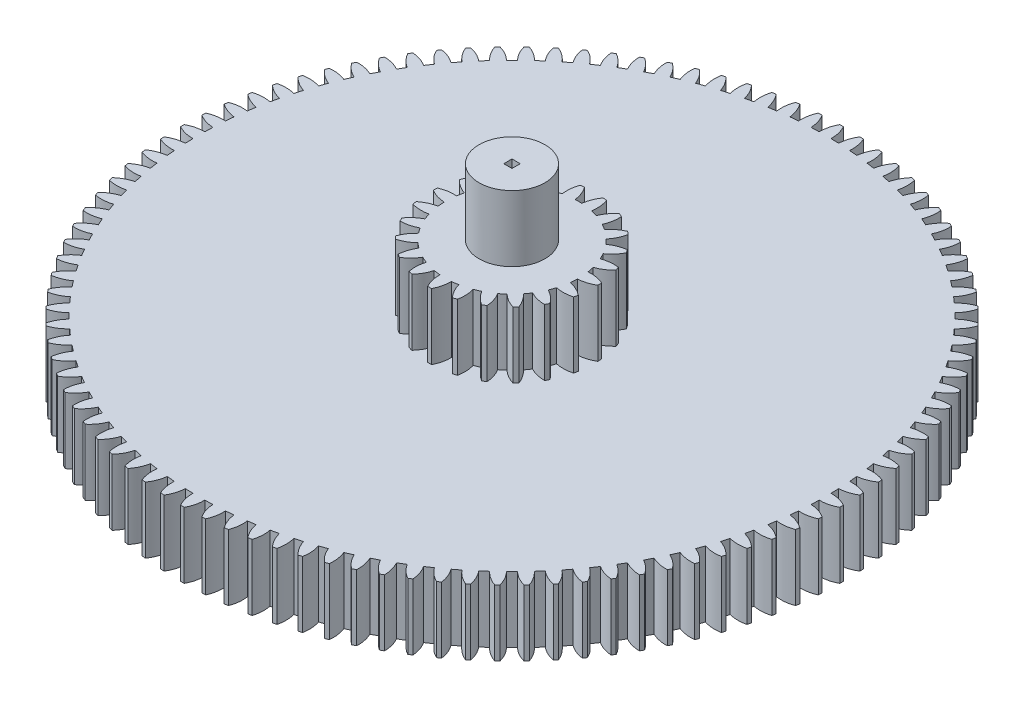
from build123d import *

# Parameters (mm, degrees)
BOSS_EXTRUDE1_DEPTH      = 1
BOSS_EXTRUDE2_DEPTH      = 2
BOSS_EXTRUDE2_DEPTH_BACK = 3
SKETCH2_R                = 0.5
BOSS_EXTRUDE3_DEPTH      = 1
SCALE1_SCALE             = 2
SKETCH4_W                = 0.25
SKETCH4_H                = 0.25
CUT_EXTRUDE1_DEPTH       = 1
SKETCH5_R                = 1
CUT_EXTRUDE2_DEPTH       = 1.4
SKETCH6_R                = 5
SKETCH6_R_2              = 1
CUT_EXTRUDE3_DEPTH       = 2
BOSS_EXTRUDE4_DEPTH      = 2


with BuildPart() as part:
    # Sketch1 → Boss-Extrude1 (new body)
    with BuildSketch(Plane(origin=(0, 0, 0), x_dir=(1, 0, 0), z_dir=(0, 1, 0))):
        with BuildLine():
            ThreePointArc((-1.122849348, 2.23365381), (-1.150162594, 2.219713046), (-1.17730279, 2.20543831))
            ThreePointArc((-1.17730279, 2.20543831), (-1.174225974, 2.07727607), (-1.131251341, 1.956494417))
            ThreePointArc((-1.131251341, 1.956494417), (-1.174259727, 1.930987854), (-1.216693282, 1.904536022))
            ThreePointArc((-1.216693282, 1.904536022), (-1.3041624, 1.998259979), (-1.416540223, 2.059954804))
            ThreePointArc((-1.416540223, 2.059954804), (-1.441700805, 2.042424733), (-1.466644473, 2.024587363))
            ThreePointArc((-1.466644473, 2.024587363), (-1.446144892, 1.898037792), (-1.387124094, 1.784232818))
            ThreePointArc((-1.387124094, 1.784232818), (-1.426258754, 1.753107517), (-1.464695223, 1.721124023))
            ThreePointArc((-1.464695223, 1.721124023), (-1.564111726, 1.802064654), (-1.683843634, 1.847882739))
            ThreePointArc((-1.683843634, 1.847882739), (-1.706382858, 1.827089911), (-1.728665344, 1.806022184))
            ThreePointArc((-1.728665344, 1.806022184), (-1.691124866, 1.683442662), (-1.617157349, 1.578734337))
            ThreePointArc((-1.617157349, 1.578734337), (-1.651689279, 1.542570104), (-1.685412664, 1.505650741))
            ThreePointArc((-1.685412664, 1.505650741), (-1.79492461, 1.572300274), (-1.919780224, 1.601388114))
            ThreePointArc((-1.919780224, 1.601388114), (-1.939278227, 1.577719861), (-1.958484451, 1.553814228))
            ThreePointArc((-1.958484451, 1.553814228), (-1.904602384, 1.43748818), (-1.817066023, 1.343827023))
            ThreePointArc((-1.817066023, 1.343827023), (-1.846351958, 1.303297528), (-1.874734055, 1.262130034))
            ThreePointArc((-1.874734055, 1.262130034), (-1.992301445, 1.313246914), (-2.119954941, 1.325062658))
            ThreePointArc((-2.119954941, 1.325062658), (-2.136048511, 1.298959875), (-2.151820698, 1.272661654))
            ThreePointArc((-2.151820698, 1.272661654), (-2.082600763, 1.164756013), (-1.983126195, 1.083886754))
            ThreePointArc((-1.983126195, 1.083886754), (-2.006620594, 1.039746985), (-2.029132698, 0.995098232))
            ThreePointArc((-2.029132698, 0.995098232), (-2.152565474, 1.02973025), (-2.280638908, 1.024053793))
            ThreePointArc((-2.280638908, 1.024053793), (-2.293028254, 0.996002725), (-2.305072596, 0.967801801))
            ThreePointArc((-2.305072596, 0.967801801), (-2.22180423, 0.870326645), (-2.112244478, 0.803755726))
            ThreePointArc((-2.112244478, 0.803755726), (-2.129509684, 0.756827924), (-2.145732439, 0.709529634))
            ThreePointArc((-2.145732439, 0.709529634), (-2.272731281, 0.727031659), (-2.398838888, 0.703968742))
            ThreePointArc((-2.398838888, 0.703968742), (-2.407293218, 0.674491928), (-2.415385354, 0.644913631))
            ThreePointArc((-2.415385354, 0.644913631), (-2.319619689, 0.559684739), (-2.202015642, 0.508652249))
            ThreePointArc((-2.202015642, 0.508652249), (-2.212730038, 0.459810589), (-2.222361244, 0.41074384))
            ThreePointArc((-2.222361244, 0.41074384), (-2.350560404, 0.410789844), (-2.472353038, 0.370770087))
            ThreePointArc((-2.472353038, 0.370770087), (-2.476714865, 0.340416623), (-2.480704053, 0.310011941))
            ThreePointArc((-2.480704053, 0.310011941), (-2.374225021, 0.238616965), (-2.250767422, 0.204073543))
            ThreePointArc((-2.250767422, 0.204073543), (-2.254731418, 0.154227854), (-2.257591664, 0.104306666))
            ThreePointArc((-2.257591664, 0.104306666), (-2.384603034, 0.086895792), (-2.499811928, 0.030664685))
            ThreePointArc((-2.499811928, 0.030664685), (-2.5, 0), (-2.499811928, -0.030664685))
            ThreePointArc((-2.499811928, -0.030664685), (-2.384603034, -0.086895792), (-2.257591664, -0.104306666))
            ThreePointArc((-2.257591664, -0.104306666), (-2.254731418, -0.154227854), (-2.250767422, -0.204073543))
            ThreePointArc((-2.250767422, -0.204073543), (-2.374225021, -0.238616965), (-2.480704053, -0.310011941))
            ThreePointArc((-2.480704053, -0.310011941), (-2.476714865, -0.340416623), (-2.472353038, -0.370770087))
            ThreePointArc((-2.472353038, -0.370770087), (-2.350560404, -0.410789844), (-2.222361244, -0.41074384))
            ThreePointArc((-2.222361244, -0.41074384), (-2.212730038, -0.459810589), (-2.202015642, -0.508652249))
            ThreePointArc((-2.202015642, -0.508652249), (-2.319619689, -0.559684739), (-2.415385354, -0.644913631))
            ThreePointArc((-2.415385354, -0.644913631), (-2.407293218, -0.674491928), (-2.398838888, -0.703968742))
            ThreePointArc((-2.398838888, -0.703968742), (-2.272731281, -0.727031659), (-2.145732439, -0.709529634))
            ThreePointArc((-2.145732439, -0.709529634), (-2.129509684, -0.756827924), (-2.112244478, -0.803755726))
            ThreePointArc((-2.112244478, -0.803755726), (-2.22180423, -0.870326645), (-2.305072596, -0.967801801))
            ThreePointArc((-2.305072596, -0.967801801), (-2.293028254, -0.996002725), (-2.280638908, -1.024053793))
            ThreePointArc((-2.280638908, -1.024053793), (-2.152565474, -1.02973025), (-2.029132698, -0.995098232))
            ThreePointArc((-2.029132698, -0.995098232), (-2.006620594, -1.039746985), (-1.983126195, -1.083886754))
            ThreePointArc((-1.983126195, -1.083886754), (-2.082600763, -1.164756013), (-2.151820698, -1.272661654))
            ThreePointArc((-2.151820698, -1.272661654), (-2.136048511, -1.298959875), (-2.119954941, -1.325062658))
            ThreePointArc((-2.119954941, -1.325062658), (-1.992301445, -1.313246914), (-1.874734055, -1.262130034))
            ThreePointArc((-1.874734055, -1.262130034), (-1.846351958, -1.303297528), (-1.817066023, -1.343827023))
            ThreePointArc((-1.817066023, -1.343827023), (-1.904602384, -1.43748818), (-1.958484451, -1.553814228))
            ThreePointArc((-1.958484451, -1.553814228), (-1.939278227, -1.577719861), (-1.919780224, -1.601388114))
            ThreePointArc((-1.919780224, -1.601388114), (-1.79492461, -1.572300274), (-1.685412664, -1.505650741))
            ThreePointArc((-1.685412664, -1.505650741), (-1.651689279, -1.542570104), (-1.617157349, -1.578734337))
            ThreePointArc((-1.617157349, -1.578734337), (-1.691124866, -1.683442662), (-1.728665344, -1.806022184))
            ThreePointArc((-1.728665344, -1.806022184), (-1.706382858, -1.827089911), (-1.683843634, -1.847882739))
            ThreePointArc((-1.683843634, -1.847882739), (-1.564111726, -1.802064654), (-1.464695223, -1.721124023))
            ThreePointArc((-1.464695223, -1.721124023), (-1.426258754, -1.753107517), (-1.387124094, -1.784232818))
            ThreePointArc((-1.387124094, -1.784232818), (-1.446144892, -1.898037792), (-1.466644473, -2.024587363))
            ThreePointArc((-1.466644473, -2.024587363), (-1.441700805, -2.042424733), (-1.416540223, -2.059954804))
            ThreePointArc((-1.416540223, -2.059954804), (-1.3041624, -1.998259979), (-1.216693282, -1.904536022))
            ThreePointArc((-1.216693282, -1.904536022), (-1.174259727, -1.930987854), (-1.131251341, -1.956494417))
            ThreePointArc((-1.131251341, -1.956494417), (-1.174225974, -2.07727607), (-1.17730279, -2.20543831))
            ThreePointArc((-1.17730279, -2.20543831), (-1.150162594, -2.219713046), (-1.122849348, -2.23365381))
            ThreePointArc((-1.122849348, -2.23365381), (-1.019918995, -2.157231501), (-0.946026647, -2.052470118))
            ThreePointArc((-0.946026647, -2.052470118), (-0.900386463, -2.072897541), (-0.854305516, -2.092310227))
            ThreePointArc((-0.854305516, -2.092310227), (-0.880433448, -2.217818624), (-0.866030184, -2.345206115))
            ThreePointArc((-0.866030184, -2.345206115), (-0.83719903, -2.355652305), (-0.808241914, -2.365744071))
            ThreePointArc((-0.808241914, -2.365744071), (-0.71667643, -2.276017883), (-0.657737325, -2.162170579))
            ThreePointArc((-0.657737325, -2.162170579), (-0.609740703, -2.176193069), (-0.561445596, -2.189150256))
            ThreePointArc((-0.561445596, -2.189150256), (-0.570240113, -2.317047414), (-0.538625074, -2.441287167))
            ThreePointArc((-0.538625074, -2.441287167), (-0.508640033, -2.447710219), (-0.478578463, -2.453764996))
            ThreePointArc((-0.478578463, -2.453764996), (-0.400083539, -2.352406357), (-0.357195602, -2.231593893))
            ThreePointArc((-0.357195602, -2.231593893), (-0.307736627, -2.238950238), (-0.258127007, -2.245210558))
            ThreePointArc((-0.258127007, -2.245210558), (-0.249424284, -2.373113995), (-0.201186398, -2.491891658))
            ThreePointArc((-0.201186398, -2.491891658), (-0.170606033, -2.494171923), (-0.14, -2.496076922))
            ThreePointArc((-0.14, -2.496076922), (-0.076037848, -2.384973952), (-0.05, -2.259446835))
            ThreePointArc((-0.05, -2.259446835), (0, -2.26), (0.05, -2.259446835))
            ThreePointArc((0.05, -2.259446835), (0.076037848, -2.384973952), (0.14, -2.496076922))
            ThreePointArc((0.14, -2.496076922), (0.170606033, -2.494171923), (0.201186398, -2.491891658))
            ThreePointArc((0.201186398, -2.491891658), (0.249424284, -2.373113995), (0.258127007, -2.245210558))
            ThreePointArc((0.258127007, -2.245210558), (0.307736627, -2.238950238), (0.357195602, -2.231593893))
            ThreePointArc((0.357195602, -2.231593893), (0.400083539, -2.352406357), (0.478578463, -2.453764996))
            ThreePointArc((0.478578463, -2.453764996), (0.508640033, -2.447710219), (0.538625074, -2.441287167))
            ThreePointArc((0.538625074, -2.441287167), (0.570240113, -2.317047414), (0.561445596, -2.189150256))
            ThreePointArc((0.561445596, -2.189150256), (0.609740703, -2.176193069), (0.657737325, -2.162170579))
            ThreePointArc((0.657737325, -2.162170579), (0.71667643, -2.276017883), (0.808241914, -2.365744071))
            ThreePointArc((0.808241914, -2.365744071), (0.83719903, -2.355652305), (0.866030184, -2.345206115))
            ThreePointArc((0.866030184, -2.345206115), (0.880433448, -2.217818624), (0.854305516, -2.092310227))
            ThreePointArc((0.854305516, -2.092310227), (0.900386463, -2.072897541), (0.946026647, -2.052470118))
            ThreePointArc((0.946026647, -2.052470118), (1.019918995, -2.157231501), (1.122849348, -2.23365381))
            ThreePointArc((1.122849348, -2.23365381), (1.150162594, -2.219713046), (1.17730279, -2.20543831))
            ThreePointArc((1.17730279, -2.20543831), (1.174225974, -2.07727607), (1.131251341, -1.956494417))
            ThreePointArc((1.131251341, -1.956494417), (1.174259727, -1.930987854), (1.216693282, -1.904536022))
            ThreePointArc((1.216693282, -1.904536022), (1.3041624, -1.998259979), (1.416540223, -2.059954804))
            ThreePointArc((1.416540223, -2.059954804), (1.441700805, -2.042424733), (1.466644473, -2.024587363))
            ThreePointArc((1.466644473, -2.024587363), (1.446144892, -1.898037792), (1.387124094, -1.784232818))
            ThreePointArc((1.387124094, -1.784232818), (1.426258754, -1.753107517), (1.464695223, -1.721124023))
            ThreePointArc((1.464695223, -1.721124023), (1.564111726, -1.802064654), (1.683843634, -1.847882739))
            ThreePointArc((1.683843634, -1.847882739), (1.706382858, -1.827089911), (1.728665344, -1.806022184))
            ThreePointArc((1.728665344, -1.806022184), (1.691124866, -1.683442662), (1.617157349, -1.578734337))
            ThreePointArc((1.617157349, -1.578734337), (1.651689279, -1.542570104), (1.685412664, -1.505650741))
            ThreePointArc((1.685412664, -1.505650741), (1.79492461, -1.572300274), (1.919780224, -1.601388114))
            ThreePointArc((1.919780224, -1.601388114), (1.939278227, -1.577719861), (1.958484451, -1.553814228))
            ThreePointArc((1.958484451, -1.553814228), (1.904602384, -1.43748818), (1.817066023, -1.343827023))
            ThreePointArc((1.817066023, -1.343827023), (1.846351958, -1.303297528), (1.874734055, -1.262130034))
            ThreePointArc((1.874734055, -1.262130034), (1.992301445, -1.313246914), (2.119954941, -1.325062658))
            ThreePointArc((2.119954941, -1.325062658), (2.136048511, -1.298959875), (2.151820698, -1.272661654))
            ThreePointArc((2.151820698, -1.272661654), (2.082600763, -1.164756013), (1.983126195, -1.083886754))
            ThreePointArc((1.983126195, -1.083886754), (2.006620594, -1.039746985), (2.029132698, -0.995098232))
            ThreePointArc((2.029132698, -0.995098232), (2.152565474, -1.02973025), (2.280638908, -1.024053793))
            ThreePointArc((2.280638908, -1.024053793), (2.293028254, -0.996002725), (2.305072596, -0.967801801))
            ThreePointArc((2.305072596, -0.967801801), (2.22180423, -0.870326645), (2.112244478, -0.803755726))
            ThreePointArc((2.112244478, -0.803755726), (2.129509684, -0.756827924), (2.145732439, -0.709529634))
            ThreePointArc((2.145732439, -0.709529634), (2.272731281, -0.727031659), (2.398838888, -0.703968742))
            ThreePointArc((2.398838888, -0.703968742), (2.407293218, -0.674491928), (2.415385354, -0.644913631))
            ThreePointArc((2.415385354, -0.644913631), (2.319619689, -0.559684739), (2.202015642, -0.508652249))
            ThreePointArc((2.202015642, -0.508652249), (2.212730038, -0.459810589), (2.222361244, -0.41074384))
            ThreePointArc((2.222361244, -0.41074384), (2.350560404, -0.410789844), (2.472353038, -0.370770087))
            ThreePointArc((2.472353038, -0.370770087), (2.476714865, -0.340416623), (2.480704053, -0.310011941))
            ThreePointArc((2.480704053, -0.310011941), (2.374225021, -0.238616965), (2.250767422, -0.204073543))
            ThreePointArc((2.250767422, -0.204073543), (2.254731418, -0.154227854), (2.257591664, -0.104306666))
            ThreePointArc((2.257591664, -0.104306666), (2.384603034, -0.086895792), (2.499811928, -0.030664685))
            ThreePointArc((2.499811928, -0.030664685), (2.5, 0), (2.499811928, 0.030664685))
            ThreePointArc((2.499811928, 0.030664685), (2.384603034, 0.086895792), (2.257591664, 0.104306666))
            ThreePointArc((2.257591664, 0.104306666), (2.254731418, 0.154227854), (2.250767422, 0.204073543))
            ThreePointArc((2.250767422, 0.204073543), (2.374225021, 0.238616965), (2.480704053, 0.310011941))
            ThreePointArc((2.480704053, 0.310011941), (2.476714865, 0.340416623), (2.472353038, 0.370770087))
            ThreePointArc((2.472353038, 0.370770087), (2.350560404, 0.410789844), (2.222361244, 0.41074384))
            ThreePointArc((2.222361244, 0.41074384), (2.212730038, 0.459810589), (2.202015642, 0.508652249))
            ThreePointArc((2.202015642, 0.508652249), (2.319619689, 0.559684739), (2.415385354, 0.644913631))
            ThreePointArc((2.415385354, 0.644913631), (2.407293218, 0.674491928), (2.398838888, 0.703968742))
            ThreePointArc((2.398838888, 0.703968742), (2.272731281, 0.727031659), (2.145732439, 0.709529634))
            ThreePointArc((2.145732439, 0.709529634), (2.129509684, 0.756827924), (2.112244478, 0.803755726))
            ThreePointArc((2.112244478, 0.803755726), (2.22180423, 0.870326645), (2.305072596, 0.967801801))
            ThreePointArc((2.305072596, 0.967801801), (2.293028254, 0.996002725), (2.280638908, 1.024053793))
            ThreePointArc((2.280638908, 1.024053793), (2.152565474, 1.02973025), (2.029132698, 0.995098232))
            ThreePointArc((2.029132698, 0.995098232), (2.006620594, 1.039746985), (1.983126195, 1.083886754))
            ThreePointArc((1.983126195, 1.083886754), (2.082600763, 1.164756013), (2.151820698, 1.272661654))
            ThreePointArc((2.151820698, 1.272661654), (2.136048511, 1.298959875), (2.119954941, 1.325062658))
            ThreePointArc((2.119954941, 1.325062658), (1.992301445, 1.313246914), (1.874734055, 1.262130034))
            ThreePointArc((1.874734055, 1.262130034), (1.846351958, 1.303297528), (1.817066023, 1.343827023))
            ThreePointArc((1.817066023, 1.343827023), (1.904602384, 1.43748818), (1.958484451, 1.553814228))
            ThreePointArc((1.958484451, 1.553814228), (1.939278227, 1.577719861), (1.919780224, 1.601388114))
            ThreePointArc((1.919780224, 1.601388114), (1.79492461, 1.572300274), (1.685412664, 1.505650741))
            ThreePointArc((1.685412664, 1.505650741), (1.651689279, 1.542570104), (1.617157349, 1.578734337))
            ThreePointArc((1.617157349, 1.578734337), (1.691124866, 1.683442662), (1.728665344, 1.806022184))
            ThreePointArc((1.728665344, 1.806022184), (1.706382858, 1.827089911), (1.683843634, 1.847882739))
            ThreePointArc((1.683843634, 1.847882739), (1.564111726, 1.802064654), (1.464695223, 1.721124023))
            ThreePointArc((1.464695223, 1.721124023), (1.426258754, 1.753107517), (1.387124094, 1.784232818))
            ThreePointArc((1.387124094, 1.784232818), (1.446144892, 1.898037792), (1.466644473, 2.024587363))
            ThreePointArc((1.466644473, 2.024587363), (1.441700805, 2.042424733), (1.416540223, 2.059954804))
            ThreePointArc((1.416540223, 2.059954804), (1.3041624, 1.998259979), (1.216693282, 1.904536022))
            ThreePointArc((1.216693282, 1.904536022), (1.174259727, 1.930987854), (1.131251341, 1.956494417))
            ThreePointArc((1.131251341, 1.956494417), (1.174225974, 2.07727607), (1.17730279, 2.20543831))
            ThreePointArc((1.17730279, 2.20543831), (1.150162594, 2.219713046), (1.122849348, 2.23365381))
            ThreePointArc((1.122849348, 2.23365381), (1.019918995, 2.157231501), (0.946026647, 2.052470118))
            ThreePointArc((0.946026647, 2.052470118), (0.900386463, 2.072897541), (0.854305516, 2.092310227))
            ThreePointArc((0.854305516, 2.092310227), (0.880433448, 2.217818624), (0.866030184, 2.345206115))
            ThreePointArc((0.866030184, 2.345206115), (0.83719903, 2.355652305), (0.808241914, 2.365744071))
            ThreePointArc((0.808241914, 2.365744071), (0.71667643, 2.276017883), (0.657737325, 2.162170579))
            ThreePointArc((0.657737325, 2.162170579), (0.609740703, 2.176193069), (0.561445596, 2.189150256))
            ThreePointArc((0.561445596, 2.189150256), (0.570240113, 2.317047414), (0.538625074, 2.441287167))
            ThreePointArc((0.538625074, 2.441287167), (0.508640033, 2.447710219), (0.478578463, 2.453764996))
            ThreePointArc((0.478578463, 2.453764996), (0.400083539, 2.352406357), (0.357195602, 2.231593893))
            ThreePointArc((0.357195602, 2.231593893), (0.307736627, 2.238950238), (0.258127007, 2.245210558))
            ThreePointArc((0.258127007, 2.245210558), (0.249424284, 2.373113995), (0.201186398, 2.491891658))
            ThreePointArc((0.201186398, 2.491891658), (0.170606033, 2.494171923), (0.14, 2.496076922))
            ThreePointArc((0.14, 2.496076922), (0.076037848, 2.384973952), (0.05, 2.259446835))
            ThreePointArc((0.05, 2.259446835), (0, 2.26), (-0.05, 2.259446835))
            ThreePointArc((-0.05, 2.259446835), (-0.076037848, 2.384973952), (-0.14, 2.496076922))
            ThreePointArc((-0.14, 2.496076922), (-0.170606033, 2.494171923), (-0.201186398, 2.491891658))
            ThreePointArc((-0.201186398, 2.491891658), (-0.249424284, 2.373113995), (-0.258127007, 2.245210558))
            ThreePointArc((-0.258127007, 2.245210558), (-0.307736627, 2.238950238), (-0.357195602, 2.231593893))
            ThreePointArc((-0.357195602, 2.231593893), (-0.400083539, 2.352406357), (-0.478578463, 2.453764996))
            ThreePointArc((-0.478578463, 2.453764996), (-0.508640033, 2.447710219), (-0.538625074, 2.441287167))
            ThreePointArc((-0.538625074, 2.441287167), (-0.570240113, 2.317047414), (-0.561445596, 2.189150256))
            ThreePointArc((-0.561445596, 2.189150256), (-0.609740703, 2.176193069), (-0.657737325, 2.162170579))
            ThreePointArc((-0.657737325, 2.162170579), (-0.71667643, 2.276017883), (-0.808241914, 2.365744071))
            ThreePointArc((-0.808241914, 2.365744071), (-0.83719903, 2.355652305), (-0.866030184, 2.345206115))
            ThreePointArc((-0.866030184, 2.345206115), (-0.880433448, 2.217818624), (-0.854305516, 2.092310227))
            ThreePointArc((-0.854305516, 2.092310227), (-0.900386463, 2.072897541), (-0.946026647, 2.052470118))
            ThreePointArc((-0.946026647, 2.052470118), (-1.019918995, 2.157231501), (-1.122849348, 2.23365381))
        make_face()
    extrude(amount=BOSS_EXTRUDE1_DEPTH)

    # Sketch2 → Boss-Extrude2 (add, two sides: drawn at the far end of the back side and taken through both)
    with BuildSketch(Plane.XZ.offset(-BOSS_EXTRUDE2_DEPTH_BACK)):
        Circle(SKETCH2_R)
    extrude(amount=BOSS_EXTRUDE2_DEPTH + BOSS_EXTRUDE2_DEPTH_BACK)

    # Sketch3 → Boss-Extrude3 (add)
    with BuildSketch(Plane(origin=(0, 1, 0), x_dir=(1, 0, 0), z_dir=(0, 1, 0))):
        with BuildLine():
            ThreePointArc((-0.566857316, 0.835926303), (-0.656545768, 0.92443348), (-0.765012261, 0.988562715))
            ThreePointArc((-0.765012261, 0.988562715), (-0.78885993, 0.969639113), (-0.812239679, 0.95014036))
            ThreePointArc((-0.812239679, 0.95014036), (-0.771519926, 0.830895064), (-0.703111612, 0.725075211))
            ThreePointArc((-0.703111612, 0.725075211), (-0.738144324, 0.689378675), (-0.771366926, 0.651991614))
            ThreePointArc((-0.771366926, 0.651991614), (-0.881608438, 0.71301905), (-1.003354559, 0.74550629))
            ThreePointArc((-1.003354559, 0.74550629), (-1.021212366, 0.720850403), (-1.03846443, 0.695766935))
            ThreePointArc((-1.03846443, 0.695766935), (-0.96708268, 0.591929637), (-0.872661277, 0.508490212))
            ThreePointArc((-0.872661277, 0.508490212), (-0.896764071, 0.464665688), (-0.918667781, 0.41970169))
            ThreePointArc((-0.918667781, 0.41970169), (-1.041286243, 0.44872326), (-1.16728264, 0.447159074))
            ThreePointArc((-1.16728264, 0.447159074), (-1.177826153, 0.418599515), (-1.187671024, 0.38979166))
            ThreePointArc((-1.187671024, 0.38979166), (-1.090921335, 0.309063496), (-0.977489647, 0.254192821))
            ThreePointArc((-0.977489647, 0.254192821), (-0.988874929, 0.205490573), (-0.997835248, 0.156284412))
            ThreePointArc((-0.997835248, 0.156284412), (-1.123736611, 0.151147718), (-1.244638708, 0.115648115))
            ThreePointArc((-1.244638708, 0.115648115), (-1.247085961, 0.085303017), (-1.248793492, 0.05490732))
            ThreePointArc((-1.248793492, 0.05490732), (-1.133851346, 0.003275529), (-1.009822082, -0.018956889))
            ThreePointArc((-1.009822082, -0.018956889), (-1.007645457, -0.068924837), (-1.00299784, -0.118723766))
            ThreePointArc((-1.00299784, -0.118723766), (-1.122844575, -0.157637759), (-1.229685616, -0.224439935))
            ThreePointArc((-1.229685616, -0.224439935), (-1.22385511, -0.254320016), (-1.21729866, -0.284049244))
            ThreePointArc((-1.21729866, -0.284049244), (-1.092688789, -0.302755369), (-0.967260632, -0.290700653))
            ThreePointArc((-0.967260632, -0.290700653), (-0.951683531, -0.338228408), (-0.933772671, -0.384926745))
            ThreePointArc((-0.933772671, -0.384926745), (-1.038676294, -0.454731964), (-1.123532368, -0.547882303))
            ThreePointArc((-1.123532368, -0.547882303), (-1.109856523, -0.575081297), (-1.095522354, -0.601939176))
            ThreePointArc((-1.095522354, -0.601939176), (-0.970486504, -0.586332286), (-0.852961886, -0.54088448))
            ThreePointArc((-0.852961886, -0.54088448), (-0.825139592, -0.582447125), (-0.795293854, -0.622581469))
            ThreePointArc((-0.795293854, -0.622581469), (-0.877474144, -0.71810078), (-0.934051864, -0.830690746))
            ThreePointArc((-0.934051864, -0.830690746), (-0.913544955, -0.853191429), (-0.892496167, -0.875186032))
            ThreePointArc((-0.892496167, -0.875186032), (-0.776307675, -0.826423619), (-0.67540286, -0.750953379))
            ThreePointArc((-0.67540286, -0.750953379), (-0.637398824, -0.783468404), (-0.597831731, -0.814062173))
            ThreePointArc((-0.597831731, -0.814062173), (-0.651193751, -0.928211346), (-0.675297006, -1.051890657))
            ThreePointArc((-0.675297006, -1.051890657), (-0.649479938, -1.068024256), (-0.623277623, -1.083524344))
            ThreePointArc((-0.623277623, -1.083524344), (-0.524553656, -1.005222894), (-0.447752293, -0.905327501))
            ThreePointArc((-0.447752293, -0.905327501), (-0.402385101, -0.926383415), (-0.356031163, -0.94516761))
            ThreePointArc((-0.356031163, -0.94516761), (-0.376617296, -1.069480723), (-0.366458458, -1.19507665))
            ThreePointArc((-0.366458458, -1.19507665), (-0.337245964, -1.203646609), (-0.307833428, -1.211502613))
            ThreePointArc((-0.307833428, -1.211502613), (-0.233895893, -1.109469385), (-0.186893986, -0.992557624))
            ThreePointArc((-0.186893986, -0.992557624), (-0.137528316, -1.000592805), (-0.087825392, -1.006174289))
            ThreePointArc((-0.087825392, -1.006174289), (-0.074108859, -1.131431607), (-0.030441363, -1.249629274))
            ThreePointArc((-0.030441363, -1.249629274), (0, -1.25), (0.030441363, -1.249629274))
            ThreePointArc((0.030441363, -1.249629274), (0.074108859, -1.131431607), (0.087825392, -1.006174289))
            ThreePointArc((0.087825392, -1.006174289), (0.137528316, -1.000592805), (0.186893986, -0.992557624))
            ThreePointArc((0.186893986, -0.992557624), (0.233895893, -1.109469385), (0.307833428, -1.211502613))
            ThreePointArc((0.307833428, -1.211502613), (0.337245964, -1.203646609), (0.366458458, -1.19507665))
            ThreePointArc((0.366458458, -1.19507665), (0.376617296, -1.069480723), (0.356031163, -0.94516761))
            ThreePointArc((0.356031163, -0.94516761), (0.402385101, -0.926383415), (0.447752293, -0.905327501))
            ThreePointArc((0.447752293, -0.905327501), (0.524553656, -1.005222894), (0.623277623, -1.083524344))
            ThreePointArc((0.623277623, -1.083524344), (0.649479938, -1.068024256), (0.675297006, -1.051890657))
            ThreePointArc((0.675297006, -1.051890657), (0.651193751, -0.928211346), (0.597831731, -0.814062173))
            ThreePointArc((0.597831731, -0.814062173), (0.637398824, -0.783468404), (0.67540286, -0.750953379))
            ThreePointArc((0.67540286, -0.750953379), (0.776307675, -0.826423619), (0.892496167, -0.875186032))
            ThreePointArc((0.892496167, -0.875186032), (0.913544955, -0.853191429), (0.934051864, -0.830690746))
            ThreePointArc((0.934051864, -0.830690746), (0.877474144, -0.71810078), (0.795293854, -0.622581469))
            ThreePointArc((0.795293854, -0.622581469), (0.825139592, -0.582447125), (0.852961886, -0.54088448))
            ThreePointArc((0.852961886, -0.54088448), (0.970486504, -0.586332286), (1.095522354, -0.601939176))
            ThreePointArc((1.095522354, -0.601939176), (1.109856523, -0.575081297), (1.123532368, -0.547882303))
            ThreePointArc((1.123532368, -0.547882303), (1.038676294, -0.454731964), (0.933772671, -0.384926745))
            ThreePointArc((0.933772671, -0.384926745), (0.951683531, -0.338228408), (0.967260632, -0.290700653))
            ThreePointArc((0.967260632, -0.290700653), (1.092688789, -0.302755369), (1.21729866, -0.284049244))
            ThreePointArc((1.21729866, -0.284049244), (1.22385511, -0.254320016), (1.229685616, -0.224439935))
            ThreePointArc((1.229685616, -0.224439935), (1.122844575, -0.157637759), (1.00299784, -0.118723766))
            ThreePointArc((1.00299784, -0.118723766), (1.007645457, -0.068924837), (1.009822082, -0.018956889))
            ThreePointArc((1.009822082, -0.018956889), (1.133851346, 0.003275529), (1.248793492, 0.05490732))
            ThreePointArc((1.248793492, 0.05490732), (1.247085961, 0.085303017), (1.244638708, 0.115648115))
            ThreePointArc((1.244638708, 0.115648115), (1.123736611, 0.151147718), (0.997835248, 0.156284412))
            ThreePointArc((0.997835248, 0.156284412), (0.988874929, 0.205490573), (0.977489647, 0.254192821))
            ThreePointArc((0.977489647, 0.254192821), (1.090921335, 0.309063496), (1.187671024, 0.38979166))
            ThreePointArc((1.187671024, 0.38979166), (1.177826153, 0.418599515), (1.16728264, 0.447159074))
            ThreePointArc((1.16728264, 0.447159074), (1.041286243, 0.44872326), (0.918667781, 0.41970169))
            ThreePointArc((0.918667781, 0.41970169), (0.896764071, 0.464665688), (0.872661277, 0.508490212))
            ThreePointArc((0.872661277, 0.508490212), (0.96708268, 0.591929637), (1.03846443, 0.695766935))
            ThreePointArc((1.03846443, 0.695766935), (1.021212366, 0.720850403), (1.003354559, 0.74550629))
            ThreePointArc((1.003354559, 0.74550629), (0.881608438, 0.71301905), (0.771366926, 0.651991614))
            ThreePointArc((0.771366926, 0.651991614), (0.738144324, 0.689378675), (0.703111612, 0.725075211))
            ThreePointArc((0.703111612, 0.725075211), (0.771519926, 0.830895064), (0.812239679, 0.95014036))
            ThreePointArc((0.812239679, 0.95014036), (0.78885993, 0.969639113), (0.765012261, 0.988562715))
            ThreePointArc((0.765012261, 0.988562715), (0.656545768, 0.92443348), (0.566857316, 0.835926303))
            ThreePointArc((0.566857316, 0.835926303), (0.52477979, 0.862963599), (0.481415375, 0.887884698))
            ThreePointArc((0.481415375, 0.887884698), (0.518737068, 1.008236806), (0.525774827, 1.134046221))
            ThreePointArc((0.525774827, 1.134046221), (0.498001362, 1.146514127), (0.469932502, 1.158301966))
            ThreePointArc((0.469932502, 1.158301966), (0.382790102, 1.067286907), (0.320306492, 0.957864161))
            ThreePointArc((0.320306492, 0.957864161), (0.272494739, 0.97254646), (0.224014763, 0.984843838))
            ThreePointArc((0.224014763, 0.984843838), (0.227481856, 1.110802237), (0.200315662, 1.233845061))
            ThreePointArc((0.200315662, 1.233845061), (0.170208311, 1.238357433), (0.14, 1.242135258))
            ThreePointArc((0.14, 1.242135258), (0.080644645, 1.130984547), (0.05, 1.008761617))
            ThreePointArc((0.05, 1.008761617), (0, 1.01), (-0.05, 1.008761617))
            ThreePointArc((-0.05, 1.008761617), (-0.080644645, 1.130984547), (-0.14, 1.242135258))
            ThreePointArc((-0.14, 1.242135258), (-0.170208311, 1.238357433), (-0.200315662, 1.233845061))
            ThreePointArc((-0.200315662, 1.233845061), (-0.227481856, 1.110802237), (-0.224014763, 0.984843838))
            ThreePointArc((-0.224014763, 0.984843838), (-0.272494739, 0.97254646), (-0.320306492, 0.957864161))
            ThreePointArc((-0.320306492, 0.957864161), (-0.382790102, 1.067286907), (-0.469932502, 1.158301966))
            ThreePointArc((-0.469932502, 1.158301966), (-0.498001362, 1.146514127), (-0.525774827, 1.134046221))
            ThreePointArc((-0.525774827, 1.134046221), (-0.518737068, 1.008236806), (-0.481415375, 0.887884698))
            ThreePointArc((-0.481415375, 0.887884698), (-0.52477979, 0.862963599), (-0.566857316, 0.835926303))
        make_face()
    extrude(amount=BOSS_EXTRUDE3_DEPTH)


with BuildPart() as part_1:
    # Scale1: scaled about (0, 0, 0)
    add(part.part.scale(SCALE1_SCALE))

    # Sketch4 → Cut-Extrude1 (cut)
    with BuildSketch(Plane(origin=(0, 6, 0), x_dir=(1, 0, 0), z_dir=(0, 1, 0))):
        Rectangle(SKETCH4_W, SKETCH4_H)
    extrude(amount=-CUT_EXTRUDE1_DEPTH, mode=Mode.SUBTRACT)

    # Sketch5 → Cut-Extrude2 (cut)
    with BuildSketch(Plane.XZ.offset(4)):
        Circle(SKETCH5_R)
    extrude(amount=-CUT_EXTRUDE2_DEPTH, mode=Mode.SUBTRACT)

    # Sketch6 → Cut-Extrude3 (cut)
    with BuildSketch(Plane.XZ):
        Circle(SKETCH6_R)
        Circle(SKETCH6_R_2, mode=Mode.SUBTRACT)
    extrude(amount=-CUT_EXTRUDE3_DEPTH, mode=Mode.SUBTRACT)

    # Sketch8 → Boss-Extrude4 (add)
    with BuildSketch(Plane.XZ.offset(-2)):
        with BuildLine():
            ThreePointArc((9.999841665, -0.056273265), (10, 0), (9.999841665, 0.056273265))
            ThreePointArc((9.999841665, 0.056273265), (9.756935311, 0.150027595), (9.498294584, 0.18))
            ThreePointArc((9.498294584, 0.18), (9.495312323, 0.298402211), (9.490854163, 0.41675804))
            ThreePointArc((9.490854163, 0.41675804), (9.747102539, 0.462911488), (9.983642689, 0.571733031))
            ThreePointArc((9.983642689, 0.571733031), (9.980267284, 0.627905195), (9.976575834, 0.684057476))
            ThreePointArc((9.976575834, 0.684057476), (9.728261917, 0.762374587), (9.468249576, 0.776047663))
            ThreePointArc((9.468249576, 0.776047663), (9.457838664, 0.894028977), (9.445957676, 1.011871327))
            ThreePointArc((9.445957676, 1.011871327), (9.698802406, 1.07402367), (9.928042837, 1.197482958))
            ThreePointArc((9.928042837, 1.197482958), (9.921147013, 1.253332336), (9.913937016, 1.309142024))
            ThreePointArc((9.913937016, 1.309142024), (9.661195518, 1.371712834), (9.400837712, 1.36903262))
            ThreePointArc((9.400837712, 1.36903262), (9.383039236, 1.486127418), (9.36378231, 1.60299122))
            ThreePointArc((9.36378231, 1.60299122), (9.61222553, 1.680897172), (9.833261535, 1.818506966))
            ThreePointArc((9.833261535, 1.818506966), (9.822872507, 1.873813146), (9.812172418, 1.929059987))
            ThreePointArc((9.812172418, 1.929059987), (9.556000794, 1.975637558), (9.296325037, 1.956614631))
            ThreePointArc((9.296325037, 1.956614631), (9.271209238, 2.072360793), (9.244652373, 2.187784839))
            ThreePointArc((9.244652373, 2.187784839), (9.487713592, 2.28113694), (9.699672842, 2.432354159))
            ThreePointArc((9.699672842, 2.432354159), (9.685831611, 2.486898872), (9.671683659, 2.541364832))
            ThreePointArc((9.671683659, 2.541364832), (9.413092901, 2.571765343), (9.155124014, 2.536474777))
            ThreePointArc((9.155124014, 2.536474777), (9.122790014, 2.650415507), (9.089038017, 2.763944271))
            ThreePointArc((9.089038017, 2.763944271), (9.325757983, 2.872374103), (9.527803972, 3.03660196))
            ThreePointArc((9.527803972, 3.03660196), (9.510565163, 3.090169944), (9.493025182, 3.143640071))
            ThreePointArc((9.493025182, 3.143640071), (9.23303583, 3.157743546), (8.977791899, 3.106324617))
            ThreePointArc((8.977791899, 3.106324617), (8.938367305, 3.218010242), (8.89755338, 3.329195677))
            ThreePointArc((8.89755338, 3.329195677), (9.126997868, 3.452275317), (9.318333213, 3.628865681))
            ThreePointArc((9.318333213, 3.628865681), (9.297764859, 3.681245527), (9.276902072, 3.733508798))
            ThreePointArc((9.276902072, 3.733508798), (9.016540186, 3.731259577), (8.765028541, 3.663915212))
            ThreePointArc((8.765028541, 3.663915212), (8.718668944, 3.772904961), (8.670954164, 3.88130827))
            ThreePointArc((8.670954164, 3.88130827), (8.892217662, 4.018551978), (9.072087249, 4.206807928))
            ThreePointArc((9.072087249, 4.206807928), (9.048270525, 4.257792916), (9.024167268, 4.308643072))
            ThreePointArc((9.024167268, 4.308643072), (8.764460376, 4.290050031), (8.517673619, 4.207046008))
            ThreePointArc((8.517673619, 4.207046008), (8.46456198, 4.312909748), (8.410134654, 4.418103111))
            ThreePointArc((8.410134654, 4.418103111), (8.622343935, 4.568969251), (8.790037902, 4.768147825))
            ThreePointArc((8.790037902, 4.768147825), (8.7630668, 4.817536741), (8.735818198, 4.8667731))
            ThreePointArc((8.735818198, 4.8667731), (8.477791245, 4.831909617), (8.236703331, 4.733573516))
            ThreePointArc((8.236703331, 4.733573516), (8.177049257, 4.83589345), (8.116124185, 4.937461718))
            ThreePointArc((8.116124185, 4.937461718), (8.318441756, 5.101354889), (8.473298291, 5.310670021))
            ThreePointArc((8.473298291, 5.310670021), (8.443279255, 5.35826795), (8.412992845, 5.405696198))
            ThreePointArc((8.412992845, 5.405696198), (8.157664145, 5.354699864), (7.923226539, 5.241419771))
            ThreePointArc((7.923226539, 5.241419771), (7.857265456, 5.33979209), (7.790083081, 5.437334419))
            ThreePointArc((7.790083081, 5.437334419), (7.981710487, 5.61360781), (8.123118443, 5.832233428))
            ThreePointArc((8.123118443, 5.832233428), (8.090169944, 5.877852523), (8.056965253, 5.923285483))
            ThreePointArc((8.056965253, 5.923285483), (7.805342472, 5.856357557), (7.57848039, 5.728580537))
            ThreePointArc((7.57848039, 5.728580537), (7.506472618, 5.82261701), (7.433298079, 5.915748446))
            ThreePointArc((7.433298079, 5.915748446), (7.613479054, 6.103706385), (7.740880357, 6.330779675))
            ThreePointArc((7.740880357, 6.330779675), (7.705132428, 6.374239897), (7.669140499, 6.417498266))
            ThreePointArc((7.669140499, 6.417498266), (7.422216678, 6.334902882), (7.203825442, 6.193133213))
            ThreePointArc((7.203825442, 6.193133213), (7.126055161, 6.282462721), (7.047177245, 6.370815716))
            ThreePointArc((7.047177245, 6.370815716), (7.215200697, 6.56971642), (7.328092553, 6.804341227))
            ThreePointArc((7.328092553, 6.804341227), (7.289686274, 6.845471059), (7.251049152, 6.886384116))
            ThreePointArc((7.251049152, 6.886384116), (7.009798786, 6.78844724), (6.800740287, 6.633244422))
            ThreePointArc((6.800740287, 6.633244422), (6.717514421, 6.717514421), (6.633244422, 6.800740287))
            ThreePointArc((6.633244422, 6.800740287), (6.78844724, 7.009798786), (6.886384116, 7.251049152))
            ThreePointArc((6.886384116, 7.251049152), (6.845471059, 7.289686274), (6.804341227, 7.328092553))
            ThreePointArc((6.804341227, 7.328092553), (6.56971642, 7.215200697), (6.370815716, 7.047177245))
            ThreePointArc((6.370815716, 7.047177245), (6.282462721, 7.126055161), (6.193133213, 7.203825442))
            ThreePointArc((6.193133213, 7.203825442), (6.334902882, 7.422216678), (6.417498266, 7.669140499))
            ThreePointArc((6.417498266, 7.669140499), (6.374239897, 7.705132428), (6.330779675, 7.740880357))
            ThreePointArc((6.330779675, 7.740880357), (6.103706385, 7.613479054), (5.915748446, 7.433298079))
            ThreePointArc((5.915748446, 7.433298079), (5.82261701, 7.506472618), (5.728580537, 7.57848039))
            ThreePointArc((5.728580537, 7.57848039), (5.856357557, 7.805342472), (5.923285483, 8.056965253))
            ThreePointArc((5.923285483, 8.056965253), (5.877852523, 8.090169944), (5.832233428, 8.123118443))
            ThreePointArc((5.832233428, 8.123118443), (5.61360781, 7.981710487), (5.437334419, 7.790083081))
            ThreePointArc((5.437334419, 7.790083081), (5.33979209, 7.857265456), (5.241419771, 7.923226539))
            ThreePointArc((5.241419771, 7.923226539), (5.354699864, 8.157664145), (5.405696198, 8.412992845))
            ThreePointArc((5.405696198, 8.412992845), (5.35826795, 8.443279255), (5.310670021, 8.473298291))
            ThreePointArc((5.310670021, 8.473298291), (5.101354889, 8.318441756), (4.937461718, 8.116124185))
            ThreePointArc((4.937461718, 8.116124185), (4.83589345, 8.177049257), (4.733573516, 8.236703331))
            ThreePointArc((4.733573516, 8.236703331), (4.831909617, 8.477791245), (4.8667731, 8.735818198))
            ThreePointArc((4.8667731, 8.735818198), (4.817536741, 8.7630668), (4.768147825, 8.790037902))
            ThreePointArc((4.768147825, 8.790037902), (4.568969251, 8.622343935), (4.418103111, 8.410134654))
            ThreePointArc((4.418103111, 8.410134654), (4.312909748, 8.46456198), (4.207046008, 8.517673619))
            ThreePointArc((4.207046008, 8.517673619), (4.290050031, 8.764460376), (4.308643072, 9.024167268))
            ThreePointArc((4.308643072, 9.024167268), (4.257792916, 9.048270525), (4.206807928, 9.072087249))
            ThreePointArc((4.206807928, 9.072087249), (4.018551978, 8.892217662), (3.88130827, 8.670954164))
            ThreePointArc((3.88130827, 8.670954164), (3.772904961, 8.718668944), (3.663915212, 8.765028541))
            ThreePointArc((3.663915212, 8.765028541), (3.731259577, 9.016540186), (3.733508798, 9.276902072))
            ThreePointArc((3.733508798, 9.276902072), (3.681245527, 9.297764859), (3.628865681, 9.318333213))
            ThreePointArc((3.628865681, 9.318333213), (3.452275317, 9.126997868), (3.329195677, 8.89755338))
            ThreePointArc((3.329195677, 8.89755338), (3.218010242, 8.938367305), (3.106324617, 8.977791899))
            ThreePointArc((3.106324617, 8.977791899), (3.157743546, 9.23303583), (3.143640071, 9.493025182))
            ThreePointArc((3.143640071, 9.493025182), (3.090169944, 9.510565163), (3.03660196, 9.527803972))
            ThreePointArc((3.03660196, 9.527803972), (2.872374103, 9.325757983), (2.763944271, 9.089038017))
            ThreePointArc((2.763944271, 9.089038017), (2.650415507, 9.122790014), (2.536474777, 9.155124014))
            ThreePointArc((2.536474777, 9.155124014), (2.571765343, 9.413092901), (2.541364832, 9.671683659))
            ThreePointArc((2.541364832, 9.671683659), (2.486898872, 9.685831611), (2.432354159, 9.699672842))
            ThreePointArc((2.432354159, 9.699672842), (2.28113694, 9.487713592), (2.187784839, 9.244652373))
            ThreePointArc((2.187784839, 9.244652373), (2.072360793, 9.271209238), (1.956614631, 9.296325037))
            ThreePointArc((1.956614631, 9.296325037), (1.975637558, 9.556000794), (1.929059987, 9.812172418))
            ThreePointArc((1.929059987, 9.812172418), (1.873813146, 9.822872507), (1.818506966, 9.833261535))
            ThreePointArc((1.818506966, 9.833261535), (1.680897172, 9.61222553), (1.60299122, 9.36378231))
            ThreePointArc((1.60299122, 9.36378231), (1.486127418, 9.383039236), (1.36903262, 9.400837712))
            ThreePointArc((1.36903262, 9.400837712), (1.371712834, 9.661195518), (1.309142024, 9.913937016))
            ThreePointArc((1.309142024, 9.913937016), (1.253332336, 9.921147013), (1.197482958, 9.928042837))
            ThreePointArc((1.197482958, 9.928042837), (1.07402367, 9.698802406), (1.011871327, 9.445957676))
            ThreePointArc((1.011871327, 9.445957676), (0.894028977, 9.457838664), (0.776047663, 9.468249576))
            ThreePointArc((0.776047663, 9.468249576), (0.762374587, 9.728261917), (0.684057476, 9.976575834))
            ThreePointArc((0.684057476, 9.976575834), (0.627905195, 9.980267284), (0.571733031, 9.983642689))
            ThreePointArc((0.571733031, 9.983642689), (0.462911488, 9.747102539), (0.41675804, 9.490854163))
            ThreePointArc((0.41675804, 9.490854163), (0.298402211, 9.495312323), (0.18, 9.498294584))
            ThreePointArc((0.18, 9.498294584), (0.150027595, 9.756935311), (0.056273265, 9.999841665))
            ThreePointArc((0.056273265, 9.999841665), (0, 10), (-0.056273265, 9.999841665))
            ThreePointArc((-0.056273265, 9.999841665), (-0.150027595, 9.756935311), (-0.18, 9.498294584))
            ThreePointArc((-0.18, 9.498294584), (-0.298402211, 9.495312323), (-0.41675804, 9.490854163))
            ThreePointArc((-0.41675804, 9.490854163), (-0.462911488, 9.747102539), (-0.571733031, 9.983642689))
            ThreePointArc((-0.571733031, 9.983642689), (-0.627905195, 9.980267284), (-0.684057476, 9.976575834))
            ThreePointArc((-0.684057476, 9.976575834), (-0.762374587, 9.728261917), (-0.776047663, 9.468249576))
            ThreePointArc((-0.776047663, 9.468249576), (-0.894028977, 9.457838664), (-1.011871327, 9.445957676))
            ThreePointArc((-1.011871327, 9.445957676), (-1.07402367, 9.698802406), (-1.197482958, 9.928042837))
            ThreePointArc((-1.197482958, 9.928042837), (-1.253332336, 9.921147013), (-1.309142024, 9.913937016))
            ThreePointArc((-1.309142024, 9.913937016), (-1.371712834, 9.661195518), (-1.36903262, 9.400837712))
            ThreePointArc((-1.36903262, 9.400837712), (-1.486127418, 9.383039236), (-1.60299122, 9.36378231))
            ThreePointArc((-1.60299122, 9.36378231), (-1.680897172, 9.61222553), (-1.818506966, 9.833261535))
            ThreePointArc((-1.818506966, 9.833261535), (-1.873813146, 9.822872507), (-1.929059987, 9.812172418))
            ThreePointArc((-1.929059987, 9.812172418), (-1.975637558, 9.556000794), (-1.956614631, 9.296325037))
            ThreePointArc((-1.956614631, 9.296325037), (-2.072360793, 9.271209238), (-2.187784839, 9.244652373))
            ThreePointArc((-2.187784839, 9.244652373), (-2.28113694, 9.487713592), (-2.432354159, 9.699672842))
            ThreePointArc((-2.432354159, 9.699672842), (-2.486898872, 9.685831611), (-2.541364832, 9.671683659))
            ThreePointArc((-2.541364832, 9.671683659), (-2.571765343, 9.413092901), (-2.536474777, 9.155124014))
            ThreePointArc((-2.536474777, 9.155124014), (-2.650415507, 9.122790014), (-2.763944271, 9.089038017))
            ThreePointArc((-2.763944271, 9.089038017), (-2.872374103, 9.325757983), (-3.03660196, 9.527803972))
            ThreePointArc((-3.03660196, 9.527803972), (-3.090169944, 9.510565163), (-3.143640071, 9.493025182))
            ThreePointArc((-3.143640071, 9.493025182), (-3.157743546, 9.23303583), (-3.106324617, 8.977791899))
            ThreePointArc((-3.106324617, 8.977791899), (-3.218010242, 8.938367305), (-3.329195677, 8.89755338))
            ThreePointArc((-3.329195677, 8.89755338), (-3.452275317, 9.126997868), (-3.628865681, 9.318333213))
            ThreePointArc((-3.628865681, 9.318333213), (-3.681245527, 9.297764859), (-3.733508798, 9.276902072))
            ThreePointArc((-3.733508798, 9.276902072), (-3.731259577, 9.016540186), (-3.663915212, 8.765028541))
            ThreePointArc((-3.663915212, 8.765028541), (-3.772904961, 8.718668944), (-3.88130827, 8.670954164))
            ThreePointArc((-3.88130827, 8.670954164), (-4.018551978, 8.892217662), (-4.206807928, 9.072087249))
            ThreePointArc((-4.206807928, 9.072087249), (-4.257792916, 9.048270525), (-4.308643072, 9.024167268))
            ThreePointArc((-4.308643072, 9.024167268), (-4.290050031, 8.764460376), (-4.207046008, 8.517673619))
            ThreePointArc((-4.207046008, 8.517673619), (-4.312909748, 8.46456198), (-4.418103111, 8.410134654))
            ThreePointArc((-4.418103111, 8.410134654), (-4.568969251, 8.622343935), (-4.768147825, 8.790037902))
            ThreePointArc((-4.768147825, 8.790037902), (-4.817536741, 8.7630668), (-4.8667731, 8.735818198))
            ThreePointArc((-4.8667731, 8.735818198), (-4.831909617, 8.477791245), (-4.733573516, 8.236703331))
            ThreePointArc((-4.733573516, 8.236703331), (-4.83589345, 8.177049257), (-4.937461718, 8.116124185))
            ThreePointArc((-4.937461718, 8.116124185), (-5.101354889, 8.318441756), (-5.310670021, 8.473298291))
            ThreePointArc((-5.310670021, 8.473298291), (-5.35826795, 8.443279255), (-5.405696198, 8.412992845))
            ThreePointArc((-5.405696198, 8.412992845), (-5.354699864, 8.157664145), (-5.241419771, 7.923226539))
            ThreePointArc((-5.241419771, 7.923226539), (-5.33979209, 7.857265456), (-5.437334419, 7.790083081))
            ThreePointArc((-5.437334419, 7.790083081), (-5.61360781, 7.981710487), (-5.832233428, 8.123118443))
            ThreePointArc((-5.832233428, 8.123118443), (-5.877852523, 8.090169944), (-5.923285483, 8.056965253))
            ThreePointArc((-5.923285483, 8.056965253), (-5.856357557, 7.805342472), (-5.728580537, 7.57848039))
            ThreePointArc((-5.728580537, 7.57848039), (-5.82261701, 7.506472618), (-5.915748446, 7.433298079))
            ThreePointArc((-5.915748446, 7.433298079), (-6.103706385, 7.613479054), (-6.330779675, 7.740880357))
            ThreePointArc((-6.330779675, 7.740880357), (-6.374239897, 7.705132428), (-6.417498266, 7.669140499))
            ThreePointArc((-6.417498266, 7.669140499), (-6.334902882, 7.422216678), (-6.193133213, 7.203825442))
            ThreePointArc((-6.193133213, 7.203825442), (-6.282462721, 7.126055161), (-6.370815716, 7.047177245))
            ThreePointArc((-6.370815716, 7.047177245), (-6.56971642, 7.215200697), (-6.804341227, 7.328092553))
            ThreePointArc((-6.804341227, 7.328092553), (-6.845471059, 7.289686274), (-6.886384116, 7.251049152))
            ThreePointArc((-6.886384116, 7.251049152), (-6.78844724, 7.009798786), (-6.633244422, 6.800740287))
            ThreePointArc((-6.633244422, 6.800740287), (-6.717514421, 6.717514421), (-6.800740287, 6.633244422))
            ThreePointArc((-6.800740287, 6.633244422), (-7.009798786, 6.78844724), (-7.251049152, 6.886384116))
            ThreePointArc((-7.251049152, 6.886384116), (-7.289686274, 6.845471059), (-7.328092553, 6.804341227))
            ThreePointArc((-7.328092553, 6.804341227), (-7.215200697, 6.56971642), (-7.047177245, 6.370815716))
            ThreePointArc((-7.047177245, 6.370815716), (-7.126055161, 6.282462721), (-7.203825442, 6.193133213))
            ThreePointArc((-7.203825442, 6.193133213), (-7.422216678, 6.334902882), (-7.669140499, 6.417498266))
            ThreePointArc((-7.669140499, 6.417498266), (-7.705132428, 6.374239897), (-7.740880357, 6.330779675))
            ThreePointArc((-7.740880357, 6.330779675), (-7.613479054, 6.103706385), (-7.433298079, 5.915748446))
            ThreePointArc((-7.433298079, 5.915748446), (-7.506472618, 5.82261701), (-7.57848039, 5.728580537))
            ThreePointArc((-7.57848039, 5.728580537), (-7.805342472, 5.856357557), (-8.056965253, 5.923285483))
            ThreePointArc((-8.056965253, 5.923285483), (-8.090169944, 5.877852523), (-8.123118443, 5.832233428))
            ThreePointArc((-8.123118443, 5.832233428), (-7.981710487, 5.61360781), (-7.790083081, 5.437334419))
            ThreePointArc((-7.790083081, 5.437334419), (-7.857265456, 5.33979209), (-7.923226539, 5.241419771))
            ThreePointArc((-7.923226539, 5.241419771), (-8.157664145, 5.354699864), (-8.412992845, 5.405696198))
            ThreePointArc((-8.412992845, 5.405696198), (-8.443279255, 5.35826795), (-8.473298291, 5.310670021))
            ThreePointArc((-8.473298291, 5.310670021), (-8.318441756, 5.101354889), (-8.116124185, 4.937461718))
            ThreePointArc((-8.116124185, 4.937461718), (-8.177049257, 4.83589345), (-8.236703331, 4.733573516))
            ThreePointArc((-8.236703331, 4.733573516), (-8.477791245, 4.831909617), (-8.735818198, 4.8667731))
            ThreePointArc((-8.735818198, 4.8667731), (-8.7630668, 4.817536741), (-8.790037902, 4.768147825))
            ThreePointArc((-8.790037902, 4.768147825), (-8.622343935, 4.568969251), (-8.410134654, 4.418103111))
            ThreePointArc((-8.410134654, 4.418103111), (-8.46456198, 4.312909748), (-8.517673619, 4.207046008))
            ThreePointArc((-8.517673619, 4.207046008), (-8.764460376, 4.290050031), (-9.024167268, 4.308643072))
            ThreePointArc((-9.024167268, 4.308643072), (-9.048270525, 4.257792916), (-9.072087249, 4.206807928))
            ThreePointArc((-9.072087249, 4.206807928), (-8.892217662, 4.018551978), (-8.670954164, 3.88130827))
            ThreePointArc((-8.670954164, 3.88130827), (-8.718668944, 3.772904961), (-8.765028541, 3.663915212))
            ThreePointArc((-8.765028541, 3.663915212), (-9.016540186, 3.731259577), (-9.276902072, 3.733508798))
            ThreePointArc((-9.276902072, 3.733508798), (-9.297764859, 3.681245527), (-9.318333213, 3.628865681))
            ThreePointArc((-9.318333213, 3.628865681), (-9.126997868, 3.452275317), (-8.89755338, 3.329195677))
            ThreePointArc((-8.89755338, 3.329195677), (-8.938367305, 3.218010242), (-8.977791899, 3.106324617))
            ThreePointArc((-8.977791899, 3.106324617), (-9.23303583, 3.157743546), (-9.493025182, 3.143640071))
            ThreePointArc((-9.493025182, 3.143640071), (-9.510565163, 3.090169944), (-9.527803972, 3.03660196))
            ThreePointArc((-9.527803972, 3.03660196), (-9.325757983, 2.872374103), (-9.089038017, 2.763944271))
            ThreePointArc((-9.089038017, 2.763944271), (-9.122790014, 2.650415507), (-9.155124014, 2.536474777))
            ThreePointArc((-9.155124014, 2.536474777), (-9.413092901, 2.571765343), (-9.671683659, 2.541364832))
            ThreePointArc((-9.671683659, 2.541364832), (-9.685831611, 2.486898872), (-9.699672842, 2.432354159))
            ThreePointArc((-9.699672842, 2.432354159), (-9.487713592, 2.28113694), (-9.244652373, 2.187784839))
            ThreePointArc((-9.244652373, 2.187784839), (-9.271209238, 2.072360793), (-9.296325037, 1.956614631))
            ThreePointArc((-9.296325037, 1.956614631), (-9.556000794, 1.975637558), (-9.812172418, 1.929059987))
            ThreePointArc((-9.812172418, 1.929059987), (-9.822872507, 1.873813146), (-9.833261535, 1.818506966))
            ThreePointArc((-9.833261535, 1.818506966), (-9.61222553, 1.680897172), (-9.36378231, 1.60299122))
            ThreePointArc((-9.36378231, 1.60299122), (-9.383039236, 1.486127418), (-9.400837712, 1.36903262))
            ThreePointArc((-9.400837712, 1.36903262), (-9.661195518, 1.371712834), (-9.913937016, 1.309142024))
            ThreePointArc((-9.913937016, 1.309142024), (-9.921147013, 1.253332336), (-9.928042837, 1.197482958))
            ThreePointArc((-9.928042837, 1.197482958), (-9.698802406, 1.07402367), (-9.445957676, 1.011871327))
            ThreePointArc((-9.445957676, 1.011871327), (-9.457838664, 0.894028977), (-9.468249576, 0.776047663))
            ThreePointArc((-9.468249576, 0.776047663), (-9.728261917, 0.762374587), (-9.976575834, 0.684057476))
            ThreePointArc((-9.976575834, 0.684057476), (-9.980267284, 0.627905195), (-9.983642689, 0.571733031))
            ThreePointArc((-9.983642689, 0.571733031), (-9.747102539, 0.462911488), (-9.490854163, 0.41675804))
            ThreePointArc((-9.490854163, 0.41675804), (-9.495312323, 0.298402211), (-9.498294584, 0.18))
            ThreePointArc((-9.498294584, 0.18), (-9.756935311, 0.150027595), (-9.999841665, 0.056273265))
            ThreePointArc((-9.999841665, 0.056273265), (-10, 0), (-9.999841665, -0.056273265))
            ThreePointArc((-9.999841665, -0.056273265), (-9.756935311, -0.150027595), (-9.498294584, -0.18))
            ThreePointArc((-9.498294584, -0.18), (-9.495312323, -0.298402211), (-9.490854163, -0.41675804))
            ThreePointArc((-9.490854163, -0.41675804), (-9.747102539, -0.462911488), (-9.983642689, -0.571733031))
            ThreePointArc((-9.983642689, -0.571733031), (-9.980267284, -0.627905195), (-9.976575834, -0.684057476))
            ThreePointArc((-9.976575834, -0.684057476), (-9.728261917, -0.762374587), (-9.468249576, -0.776047663))
            ThreePointArc((-9.468249576, -0.776047663), (-9.457838664, -0.894028977), (-9.445957676, -1.011871327))
            ThreePointArc((-9.445957676, -1.011871327), (-9.698802406, -1.07402367), (-9.928042837, -1.197482958))
            ThreePointArc((-9.928042837, -1.197482958), (-9.921147013, -1.253332336), (-9.913937016, -1.309142024))
            ThreePointArc((-9.913937016, -1.309142024), (-9.661195518, -1.371712834), (-9.400837712, -1.36903262))
            ThreePointArc((-9.400837712, -1.36903262), (-9.383039236, -1.486127418), (-9.36378231, -1.60299122))
            ThreePointArc((-9.36378231, -1.60299122), (-9.61222553, -1.680897172), (-9.833261535, -1.818506966))
            ThreePointArc((-9.833261535, -1.818506966), (-9.822872507, -1.873813146), (-9.812172418, -1.929059987))
            ThreePointArc((-9.812172418, -1.929059987), (-9.556000794, -1.975637558), (-9.296325037, -1.956614631))
            ThreePointArc((-9.296325037, -1.956614631), (-9.271209238, -2.072360793), (-9.244652373, -2.187784839))
            ThreePointArc((-9.244652373, -2.187784839), (-9.487713592, -2.28113694), (-9.699672842, -2.432354159))
            ThreePointArc((-9.699672842, -2.432354159), (-9.685831611, -2.486898872), (-9.671683659, -2.541364832))
            ThreePointArc((-9.671683659, -2.541364832), (-9.413092901, -2.571765343), (-9.155124014, -2.536474777))
            ThreePointArc((-9.155124014, -2.536474777), (-9.122790014, -2.650415507), (-9.089038017, -2.763944271))
            ThreePointArc((-9.089038017, -2.763944271), (-9.325757983, -2.872374103), (-9.527803972, -3.03660196))
            ThreePointArc((-9.527803972, -3.03660196), (-9.510565163, -3.090169944), (-9.493025182, -3.143640071))
            ThreePointArc((-9.493025182, -3.143640071), (-9.23303583, -3.157743546), (-8.977791899, -3.106324617))
            ThreePointArc((-8.977791899, -3.106324617), (-8.938367305, -3.218010242), (-8.89755338, -3.329195677))
            ThreePointArc((-8.89755338, -3.329195677), (-9.126997868, -3.452275317), (-9.318333213, -3.628865681))
            ThreePointArc((-9.318333213, -3.628865681), (-9.297764859, -3.681245527), (-9.276902072, -3.733508798))
            ThreePointArc((-9.276902072, -3.733508798), (-9.016540186, -3.731259577), (-8.765028541, -3.663915212))
            ThreePointArc((-8.765028541, -3.663915212), (-8.718668944, -3.772904961), (-8.670954164, -3.88130827))
            ThreePointArc((-8.670954164, -3.88130827), (-8.892217662, -4.018551978), (-9.072087249, -4.206807928))
            ThreePointArc((-9.072087249, -4.206807928), (-9.048270525, -4.257792916), (-9.024167268, -4.308643072))
            ThreePointArc((-9.024167268, -4.308643072), (-8.764460376, -4.290050031), (-8.517673619, -4.207046008))
            ThreePointArc((-8.517673619, -4.207046008), (-8.46456198, -4.312909748), (-8.410134654, -4.418103111))
            ThreePointArc((-8.410134654, -4.418103111), (-8.622343935, -4.568969251), (-8.790037902, -4.768147825))
            ThreePointArc((-8.790037902, -4.768147825), (-8.7630668, -4.817536741), (-8.735818198, -4.8667731))
            ThreePointArc((-8.735818198, -4.8667731), (-8.477791245, -4.831909617), (-8.236703331, -4.733573516))
            ThreePointArc((-8.236703331, -4.733573516), (-8.177049257, -4.83589345), (-8.116124185, -4.937461718))
            ThreePointArc((-8.116124185, -4.937461718), (-8.318441756, -5.101354889), (-8.473298291, -5.310670021))
            ThreePointArc((-8.473298291, -5.310670021), (-8.443279255, -5.35826795), (-8.412992845, -5.405696198))
            ThreePointArc((-8.412992845, -5.405696198), (-8.157664145, -5.354699864), (-7.923226539, -5.241419771))
            ThreePointArc((-7.923226539, -5.241419771), (-7.857265456, -5.33979209), (-7.790083081, -5.437334419))
            ThreePointArc((-7.790083081, -5.437334419), (-7.981710487, -5.61360781), (-8.123118443, -5.832233428))
            ThreePointArc((-8.123118443, -5.832233428), (-8.090169944, -5.877852523), (-8.056965253, -5.923285483))
            ThreePointArc((-8.056965253, -5.923285483), (-7.805342472, -5.856357557), (-7.57848039, -5.728580537))
            ThreePointArc((-7.57848039, -5.728580537), (-7.506472618, -5.82261701), (-7.433298079, -5.915748446))
            ThreePointArc((-7.433298079, -5.915748446), (-7.613479054, -6.103706385), (-7.740880357, -6.330779675))
            ThreePointArc((-7.740880357, -6.330779675), (-7.705132428, -6.374239897), (-7.669140499, -6.417498266))
            ThreePointArc((-7.669140499, -6.417498266), (-7.422216678, -6.334902882), (-7.203825442, -6.193133213))
            ThreePointArc((-7.203825442, -6.193133213), (-7.126055161, -6.282462721), (-7.047177245, -6.370815716))
            ThreePointArc((-7.047177245, -6.370815716), (-7.215200697, -6.56971642), (-7.328092553, -6.804341227))
            ThreePointArc((-7.328092553, -6.804341227), (-7.289686274, -6.845471059), (-7.251049152, -6.886384116))
            ThreePointArc((-7.251049152, -6.886384116), (-7.009798786, -6.78844724), (-6.800740287, -6.633244422))
            ThreePointArc((-6.800740287, -6.633244422), (-6.717514421, -6.717514421), (-6.633244422, -6.800740287))
            ThreePointArc((-6.633244422, -6.800740287), (-6.78844724, -7.009798786), (-6.886384116, -7.251049152))
            ThreePointArc((-6.886384116, -7.251049152), (-6.845471059, -7.289686274), (-6.804341227, -7.328092553))
            ThreePointArc((-6.804341227, -7.328092553), (-6.56971642, -7.215200697), (-6.370815716, -7.047177245))
            ThreePointArc((-6.370815716, -7.047177245), (-6.282462721, -7.126055161), (-6.193133213, -7.203825442))
            ThreePointArc((-6.193133213, -7.203825442), (-6.334902882, -7.422216678), (-6.417498266, -7.669140499))
            ThreePointArc((-6.417498266, -7.669140499), (-6.374239897, -7.705132428), (-6.330779675, -7.740880357))
            ThreePointArc((-6.330779675, -7.740880357), (-6.103706385, -7.613479054), (-5.915748446, -7.433298079))
            ThreePointArc((-5.915748446, -7.433298079), (-5.82261701, -7.506472618), (-5.728580537, -7.57848039))
            ThreePointArc((-5.728580537, -7.57848039), (-5.856357557, -7.805342472), (-5.923285483, -8.056965253))
            ThreePointArc((-5.923285483, -8.056965253), (-5.877852523, -8.090169944), (-5.832233428, -8.123118443))
            ThreePointArc((-5.832233428, -8.123118443), (-5.61360781, -7.981710487), (-5.437334419, -7.790083081))
            ThreePointArc((-5.437334419, -7.790083081), (-5.33979209, -7.857265456), (-5.241419771, -7.923226539))
            ThreePointArc((-5.241419771, -7.923226539), (-5.354699864, -8.157664145), (-5.405696198, -8.412992845))
            ThreePointArc((-5.405696198, -8.412992845), (-5.35826795, -8.443279255), (-5.310670021, -8.473298291))
            ThreePointArc((-5.310670021, -8.473298291), (-5.101354889, -8.318441756), (-4.937461718, -8.116124185))
            ThreePointArc((-4.937461718, -8.116124185), (-4.83589345, -8.177049257), (-4.733573516, -8.236703331))
            ThreePointArc((-4.733573516, -8.236703331), (-4.831909617, -8.477791245), (-4.8667731, -8.735818198))
            ThreePointArc((-4.8667731, -8.735818198), (-4.817536741, -8.7630668), (-4.768147825, -8.790037902))
            ThreePointArc((-4.768147825, -8.790037902), (-4.568969251, -8.622343935), (-4.418103111, -8.410134654))
            ThreePointArc((-4.418103111, -8.410134654), (-4.312909748, -8.46456198), (-4.207046008, -8.517673619))
            ThreePointArc((-4.207046008, -8.517673619), (-4.290050031, -8.764460376), (-4.308643072, -9.024167268))
            ThreePointArc((-4.308643072, -9.024167268), (-4.257792916, -9.048270525), (-4.206807928, -9.072087249))
            ThreePointArc((-4.206807928, -9.072087249), (-4.018551978, -8.892217662), (-3.88130827, -8.670954164))
            ThreePointArc((-3.88130827, -8.670954164), (-3.772904961, -8.718668944), (-3.663915212, -8.765028541))
            ThreePointArc((-3.663915212, -8.765028541), (-3.731259577, -9.016540186), (-3.733508798, -9.276902072))
            ThreePointArc((-3.733508798, -9.276902072), (-3.681245527, -9.297764859), (-3.628865681, -9.318333213))
            ThreePointArc((-3.628865681, -9.318333213), (-3.452275317, -9.126997868), (-3.329195677, -8.89755338))
            ThreePointArc((-3.329195677, -8.89755338), (-3.218010242, -8.938367305), (-3.106324617, -8.977791899))
            ThreePointArc((-3.106324617, -8.977791899), (-3.157743546, -9.23303583), (-3.143640071, -9.493025182))
            ThreePointArc((-3.143640071, -9.493025182), (-3.090169944, -9.510565163), (-3.03660196, -9.527803972))
            ThreePointArc((-3.03660196, -9.527803972), (-2.872374103, -9.325757983), (-2.763944271, -9.089038017))
            ThreePointArc((-2.763944271, -9.089038017), (-2.650415507, -9.122790014), (-2.536474777, -9.155124014))
            ThreePointArc((-2.536474777, -9.155124014), (-2.571765343, -9.413092901), (-2.541364832, -9.671683659))
            ThreePointArc((-2.541364832, -9.671683659), (-2.486898872, -9.685831611), (-2.432354159, -9.699672842))
            ThreePointArc((-2.432354159, -9.699672842), (-2.28113694, -9.487713592), (-2.187784839, -9.244652373))
            ThreePointArc((-2.187784839, -9.244652373), (-2.072360793, -9.271209238), (-1.956614631, -9.296325037))
            ThreePointArc((-1.956614631, -9.296325037), (-1.975637558, -9.556000794), (-1.929059987, -9.812172418))
            ThreePointArc((-1.929059987, -9.812172418), (-1.873813146, -9.822872507), (-1.818506966, -9.833261535))
            ThreePointArc((-1.818506966, -9.833261535), (-1.680897172, -9.61222553), (-1.60299122, -9.36378231))
            ThreePointArc((-1.60299122, -9.36378231), (-1.486127418, -9.383039236), (-1.36903262, -9.400837712))
            ThreePointArc((-1.36903262, -9.400837712), (-1.371712834, -9.661195518), (-1.309142024, -9.913937016))
            ThreePointArc((-1.309142024, -9.913937016), (-1.253332336, -9.921147013), (-1.197482958, -9.928042837))
            ThreePointArc((-1.197482958, -9.928042837), (-1.07402367, -9.698802406), (-1.011871327, -9.445957676))
            ThreePointArc((-1.011871327, -9.445957676), (-0.894028977, -9.457838664), (-0.776047663, -9.468249576))
            ThreePointArc((-0.776047663, -9.468249576), (-0.762374587, -9.728261917), (-0.684057476, -9.976575834))
            ThreePointArc((-0.684057476, -9.976575834), (-0.627905195, -9.980267284), (-0.571733031, -9.983642689))
            ThreePointArc((-0.571733031, -9.983642689), (-0.462911488, -9.747102539), (-0.41675804, -9.490854163))
            ThreePointArc((-0.41675804, -9.490854163), (-0.298402211, -9.495312323), (-0.18, -9.498294584))
            ThreePointArc((-0.18, -9.498294584), (-0.150027595, -9.756935311), (-0.056273265, -9.999841665))
            ThreePointArc((-0.056273265, -9.999841665), (0, -10), (0.056273265, -9.999841665))
            ThreePointArc((0.056273265, -9.999841665), (0.150027595, -9.756935311), (0.18, -9.498294584))
            ThreePointArc((0.18, -9.498294584), (0.298402211, -9.495312323), (0.41675804, -9.490854163))
            ThreePointArc((0.41675804, -9.490854163), (0.462911488, -9.747102539), (0.571733031, -9.983642689))
            ThreePointArc((0.571733031, -9.983642689), (0.627905195, -9.980267284), (0.684057476, -9.976575834))
            ThreePointArc((0.684057476, -9.976575834), (0.762374587, -9.728261917), (0.776047663, -9.468249576))
            ThreePointArc((0.776047663, -9.468249576), (0.894028977, -9.457838664), (1.011871327, -9.445957676))
            ThreePointArc((1.011871327, -9.445957676), (1.07402367, -9.698802406), (1.197482958, -9.928042837))
            ThreePointArc((1.197482958, -9.928042837), (1.253332336, -9.921147013), (1.309142024, -9.913937016))
            ThreePointArc((1.309142024, -9.913937016), (1.371712834, -9.661195518), (1.36903262, -9.400837712))
            ThreePointArc((1.36903262, -9.400837712), (1.486127418, -9.383039236), (1.60299122, -9.36378231))
            ThreePointArc((1.60299122, -9.36378231), (1.680897172, -9.61222553), (1.818506966, -9.833261535))
            ThreePointArc((1.818506966, -9.833261535), (1.873813146, -9.822872507), (1.929059987, -9.812172418))
            ThreePointArc((1.929059987, -9.812172418), (1.975637558, -9.556000794), (1.956614631, -9.296325037))
            ThreePointArc((1.956614631, -9.296325037), (2.072360793, -9.271209238), (2.187784839, -9.244652373))
            ThreePointArc((2.187784839, -9.244652373), (2.28113694, -9.487713592), (2.432354159, -9.699672842))
            ThreePointArc((2.432354159, -9.699672842), (2.486898872, -9.685831611), (2.541364832, -9.671683659))
            ThreePointArc((2.541364832, -9.671683659), (2.571765343, -9.413092901), (2.536474777, -9.155124014))
            ThreePointArc((2.536474777, -9.155124014), (2.650415507, -9.122790014), (2.763944271, -9.089038017))
            ThreePointArc((2.763944271, -9.089038017), (2.872374103, -9.325757983), (3.03660196, -9.527803972))
            ThreePointArc((3.03660196, -9.527803972), (3.090169944, -9.510565163), (3.143640071, -9.493025182))
            ThreePointArc((3.143640071, -9.493025182), (3.157743546, -9.23303583), (3.106324617, -8.977791899))
            ThreePointArc((3.106324617, -8.977791899), (3.218010242, -8.938367305), (3.329195677, -8.89755338))
            ThreePointArc((3.329195677, -8.89755338), (3.452275317, -9.126997868), (3.628865681, -9.318333213))
            ThreePointArc((3.628865681, -9.318333213), (3.681245527, -9.297764859), (3.733508798, -9.276902072))
            ThreePointArc((3.733508798, -9.276902072), (3.731259577, -9.016540186), (3.663915212, -8.765028541))
            ThreePointArc((3.663915212, -8.765028541), (3.772904961, -8.718668944), (3.88130827, -8.670954164))
            ThreePointArc((3.88130827, -8.670954164), (4.018551978, -8.892217662), (4.206807928, -9.072087249))
            ThreePointArc((4.206807928, -9.072087249), (4.257792916, -9.048270525), (4.308643072, -9.024167268))
            ThreePointArc((4.308643072, -9.024167268), (4.290050031, -8.764460376), (4.207046008, -8.517673619))
            ThreePointArc((4.207046008, -8.517673619), (4.312909748, -8.46456198), (4.418103111, -8.410134654))
            ThreePointArc((4.418103111, -8.410134654), (4.568969251, -8.622343935), (4.768147825, -8.790037902))
            ThreePointArc((4.768147825, -8.790037902), (4.817536741, -8.7630668), (4.8667731, -8.735818198))
            ThreePointArc((4.8667731, -8.735818198), (4.831909617, -8.477791245), (4.733573516, -8.236703331))
            ThreePointArc((4.733573516, -8.236703331), (4.83589345, -8.177049257), (4.937461718, -8.116124185))
            ThreePointArc((4.937461718, -8.116124185), (5.101354889, -8.318441756), (5.310670021, -8.473298291))
            ThreePointArc((5.310670021, -8.473298291), (5.35826795, -8.443279255), (5.405696198, -8.412992845))
            ThreePointArc((5.405696198, -8.412992845), (5.354699864, -8.157664145), (5.241419771, -7.923226539))
            ThreePointArc((5.241419771, -7.923226539), (5.33979209, -7.857265456), (5.437334419, -7.790083081))
            ThreePointArc((5.437334419, -7.790083081), (5.61360781, -7.981710487), (5.832233428, -8.123118443))
            ThreePointArc((5.832233428, -8.123118443), (5.877852523, -8.090169944), (5.923285483, -8.056965253))
            ThreePointArc((5.923285483, -8.056965253), (5.856357557, -7.805342472), (5.728580537, -7.57848039))
            ThreePointArc((5.728580537, -7.57848039), (5.82261701, -7.506472618), (5.915748446, -7.433298079))
            ThreePointArc((5.915748446, -7.433298079), (6.103706385, -7.613479054), (6.330779675, -7.740880357))
            ThreePointArc((6.330779675, -7.740880357), (6.374239897, -7.705132428), (6.417498266, -7.669140499))
            ThreePointArc((6.417498266, -7.669140499), (6.334902882, -7.422216678), (6.193133213, -7.203825442))
            ThreePointArc((6.193133213, -7.203825442), (6.282462721, -7.126055161), (6.370815716, -7.047177245))
            ThreePointArc((6.370815716, -7.047177245), (6.56971642, -7.215200697), (6.804341227, -7.328092553))
            ThreePointArc((6.804341227, -7.328092553), (6.845471059, -7.289686274), (6.886384116, -7.251049152))
            ThreePointArc((6.886384116, -7.251049152), (6.78844724, -7.009798786), (6.633244422, -6.800740287))
            ThreePointArc((6.633244422, -6.800740287), (6.717514421, -6.717514421), (6.800740287, -6.633244422))
            ThreePointArc((6.800740287, -6.633244422), (7.009798786, -6.78844724), (7.251049152, -6.886384116))
            ThreePointArc((7.251049152, -6.886384116), (7.289686274, -6.845471059), (7.328092553, -6.804341227))
            ThreePointArc((7.328092553, -6.804341227), (7.215200697, -6.56971642), (7.047177245, -6.370815716))
            ThreePointArc((7.047177245, -6.370815716), (7.126055161, -6.282462721), (7.203825442, -6.193133213))
            ThreePointArc((7.203825442, -6.193133213), (7.422216678, -6.334902882), (7.669140499, -6.417498266))
            ThreePointArc((7.669140499, -6.417498266), (7.705132428, -6.374239897), (7.740880357, -6.330779675))
            ThreePointArc((7.740880357, -6.330779675), (7.613479054, -6.103706385), (7.433298079, -5.915748446))
            ThreePointArc((7.433298079, -5.915748446), (7.506472618, -5.82261701), (7.57848039, -5.728580537))
            ThreePointArc((7.57848039, -5.728580537), (7.805342472, -5.856357557), (8.056965253, -5.923285483))
            ThreePointArc((8.056965253, -5.923285483), (8.090169944, -5.877852523), (8.123118443, -5.832233428))
            ThreePointArc((8.123118443, -5.832233428), (7.981710487, -5.61360781), (7.790083081, -5.437334419))
            ThreePointArc((7.790083081, -5.437334419), (7.857265456, -5.33979209), (7.923226539, -5.241419771))
            ThreePointArc((7.923226539, -5.241419771), (8.157664145, -5.354699864), (8.412992845, -5.405696198))
            ThreePointArc((8.412992845, -5.405696198), (8.443279255, -5.35826795), (8.473298291, -5.310670021))
            ThreePointArc((8.473298291, -5.310670021), (8.318441756, -5.101354889), (8.116124185, -4.937461718))
            ThreePointArc((8.116124185, -4.937461718), (8.177049257, -4.83589345), (8.236703331, -4.733573516))
            ThreePointArc((8.236703331, -4.733573516), (8.477791245, -4.831909617), (8.735818198, -4.8667731))
            ThreePointArc((8.735818198, -4.8667731), (8.7630668, -4.817536741), (8.790037902, -4.768147825))
            ThreePointArc((8.790037902, -4.768147825), (8.622343935, -4.568969251), (8.410134654, -4.418103111))
            ThreePointArc((8.410134654, -4.418103111), (8.46456198, -4.312909748), (8.517673619, -4.207046008))
            ThreePointArc((8.517673619, -4.207046008), (8.764460376, -4.290050031), (9.024167268, -4.308643072))
            ThreePointArc((9.024167268, -4.308643072), (9.048270525, -4.257792916), (9.072087249, -4.206807928))
            ThreePointArc((9.072087249, -4.206807928), (8.892217662, -4.018551978), (8.670954164, -3.88130827))
            ThreePointArc((8.670954164, -3.88130827), (8.718668944, -3.772904961), (8.765028541, -3.663915212))
            ThreePointArc((8.765028541, -3.663915212), (9.016540186, -3.731259577), (9.276902072, -3.733508798))
            ThreePointArc((9.276902072, -3.733508798), (9.297764859, -3.681245527), (9.318333213, -3.628865681))
            ThreePointArc((9.318333213, -3.628865681), (9.126997868, -3.452275317), (8.89755338, -3.329195677))
            ThreePointArc((8.89755338, -3.329195677), (8.938367305, -3.218010242), (8.977791899, -3.106324617))
            ThreePointArc((8.977791899, -3.106324617), (9.23303583, -3.157743546), (9.493025182, -3.143640071))
            ThreePointArc((9.493025182, -3.143640071), (9.510565163, -3.090169944), (9.527803972, -3.03660196))
            ThreePointArc((9.527803972, -3.03660196), (9.325757983, -2.872374103), (9.089038017, -2.763944271))
            ThreePointArc((9.089038017, -2.763944271), (9.122790014, -2.650415507), (9.155124014, -2.536474777))
            ThreePointArc((9.155124014, -2.536474777), (9.413092901, -2.571765343), (9.671683659, -2.541364832))
            ThreePointArc((9.671683659, -2.541364832), (9.685831611, -2.486898872), (9.699672842, -2.432354159))
            ThreePointArc((9.699672842, -2.432354159), (9.487713592, -2.28113694), (9.244652373, -2.187784839))
            ThreePointArc((9.244652373, -2.187784839), (9.271209238, -2.072360793), (9.296325037, -1.956614631))
            ThreePointArc((9.296325037, -1.956614631), (9.556000794, -1.975637558), (9.812172418, -1.929059987))
            ThreePointArc((9.812172418, -1.929059987), (9.822872507, -1.873813146), (9.833261535, -1.818506966))
            ThreePointArc((9.833261535, -1.818506966), (9.61222553, -1.680897172), (9.36378231, -1.60299122))
            ThreePointArc((9.36378231, -1.60299122), (9.383039236, -1.486127418), (9.400837712, -1.36903262))
            ThreePointArc((9.400837712, -1.36903262), (9.661195518, -1.371712834), (9.913937016, -1.309142024))
            ThreePointArc((9.913937016, -1.309142024), (9.921147013, -1.253332336), (9.928042837, -1.197482958))
            ThreePointArc((9.928042837, -1.197482958), (9.698802406, -1.07402367), (9.445957676, -1.011871327))
            ThreePointArc((9.445957676, -1.011871327), (9.457838664, -0.894028977), (9.468249576, -0.776047663))
            ThreePointArc((9.468249576, -0.776047663), (9.728261917, -0.762374587), (9.976575834, -0.684057476))
            ThreePointArc((9.976575834, -0.684057476), (9.980267284, -0.627905195), (9.983642689, -0.571733031))
            ThreePointArc((9.983642689, -0.571733031), (9.747102539, -0.462911488), (9.490854163, -0.41675804))
            ThreePointArc((9.490854163, -0.41675804), (9.495312323, -0.298402211), (9.498294584, -0.18))
            ThreePointArc((9.498294584, -0.18), (9.756935311, -0.150027595), (9.999841665, -0.056273265))
        make_face()
    extrude(amount=BOSS_EXTRUDE4_DEPTH)


solid = part_1.part
